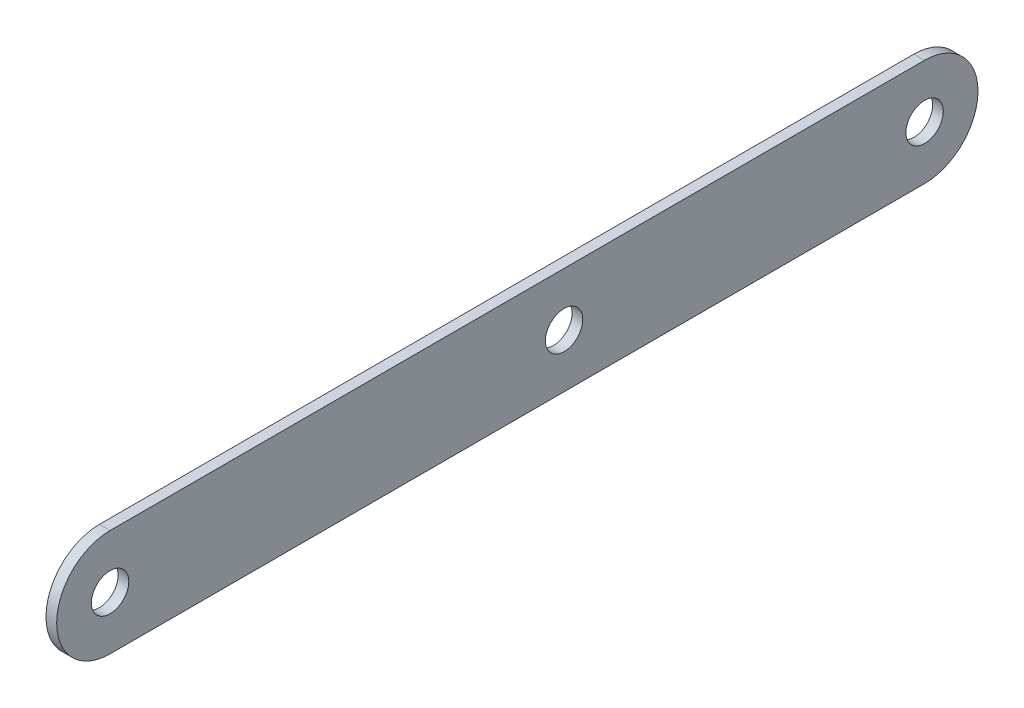
from build123d import *

# Parameters (mm, degrees)
SKETCH_1_R             = 7
SM_BASE_FLANGE_1_DEPTH = 4


# Sheet-metal steps are written as plain solids
with BuildPart() as part:
    # Sketch 1 → Базовая кромка1 (new body)
    with BuildSketch(Plane(origin=(0, 0, 0), x_dir=(0, 0, -1), z_dir=(1, 0, 0))):
        with BuildLine():
            Line((0, 20), (305, 20))
            ThreePointArc((305, 20), (325, 0), (305, -20))
            Line((305, -20), (0, -20))
            ThreePointArc((0, -20), (-20, 0), (0, 20))
        make_face()
        Circle(SKETCH_1_R, mode=Mode.SUBTRACT)
        with Locations((305, 0)):
            Circle(SKETCH_1_R, mode=Mode.SUBTRACT)
        with Locations((170, 0)):
            Circle(SKETCH_1_R, mode=Mode.SUBTRACT)
    extrude(amount=-SM_BASE_FLANGE_1_DEPTH)


solid = part.part
